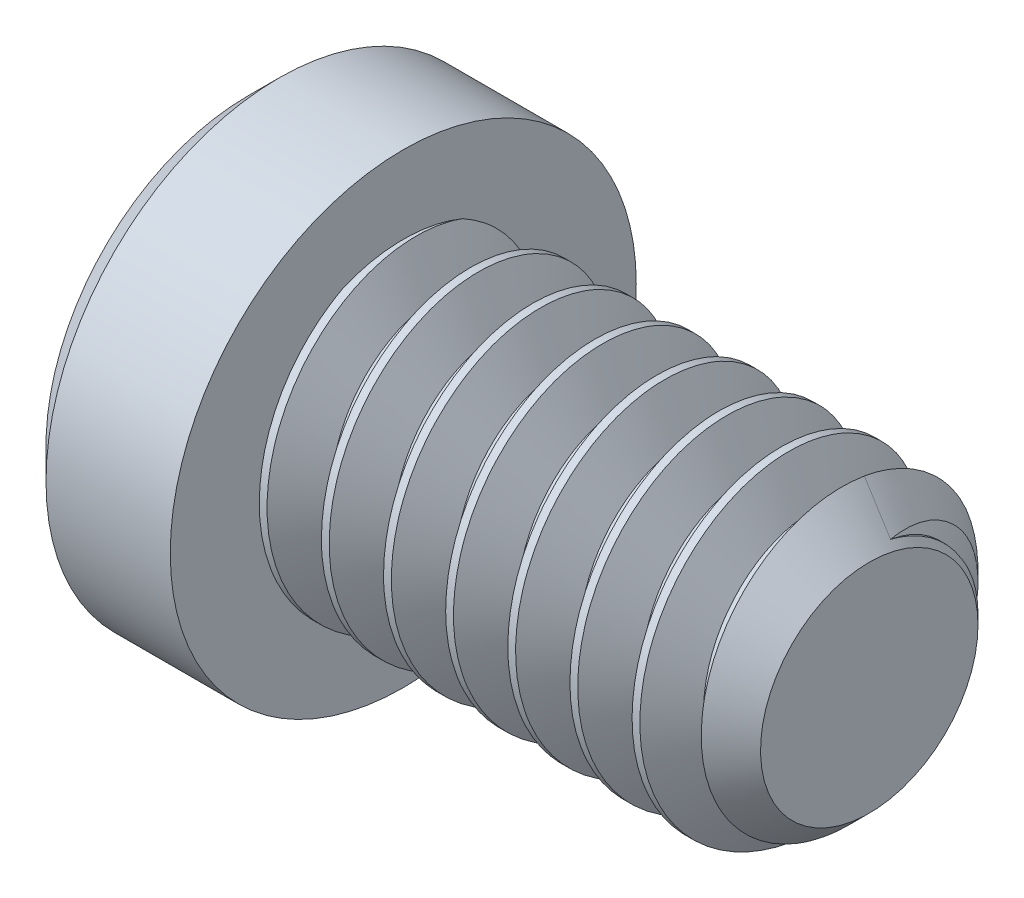
from build123d import *

# Parameters (mm, degrees)
SKETCH2_R           = 3.175
BOSS_EXTRUDE1_DEPTH = 9.525
CHAMFER1_SIZE       = 0.9525
CUT_SWEEP1_PITCH    = 1.27
CUT_EXTRUDE1_DEPTH  = 2.3876


with BuildPart() as part:
    # Sketch2 → Boss-Extrude1 (new body)
    with BuildSketch(Plane(origin=(4.7625, 0, 0), x_dir=(0, 0, -1), z_dir=(1, 0, 0))):
        Circle(SKETCH2_R)
    extrude(amount=-BOSS_EXTRUDE1_DEPTH)

    # Chamfer1
    chamfer1_edges = [part.edges().sort_by_distance(p)[0] for p in [
        (4.7625, 0, 3.175),
    ]]
    chamfer(chamfer1_edges, length=CHAMFER1_SIZE)

    # Cut-Sweep1: the profile of Sketch5 profile screwed along a right-hand helix of 8.5 turns, 8 arcs to a turn; built about Z, then put on its axis
    cut_sweep1_z = Axis((0, 0, 0), (0, 0, 1))
    cut_sweep1_corners = [(3.1753, 0, 0.555798205), (3.1753, 0, -0.555798205), (2.350110803, 0, -0.079375), (2.350110803, 0, 0.079375)]
    with BuildLine(mode=Mode.PRIVATE) as cut_sweep1_profile:
        Line(cut_sweep1_corners[0], cut_sweep1_corners[1])
        Line(cut_sweep1_corners[1], cut_sweep1_corners[2])
        Line(cut_sweep1_corners[2], cut_sweep1_corners[3])
        Line(cut_sweep1_corners[3], cut_sweep1_corners[0])
    cut_sweep1_cap = Face(cut_sweep1_profile.wire())
    cut_sweep1_turn_angles = [0, 22.5, 45, 67.5, 90, 112.5, 135, 157.5, 180, 202.5, 225, 247.5, 270, 292.5, 315, 337.5, 360]
    cut_sweep1_turn_weights = [1, 0.9238795325112867, 1, 0.9238795325112867, 1, 0.9238795325112867, 1, 0.9238795325112867, 1, 0.9238795325112867, 1, 0.9238795325112867, 1, 0.9238795325112867, 1, 0.9238795325112867, 1]
    cut_sweep1_turn_rails = [Edge.make_bspline([Vector(p[0], p[1], 0).rotate(cut_sweep1_z, cut_sweep1_turn_angles[k]) / cut_sweep1_turn_weights[k] + Vector(0, 0, p[2] + CUT_SWEEP1_PITCH * cut_sweep1_turn_angles[k] / 360) for k in range(17)], [0, 0, 0, 1, 1, 2, 2, 3, 3, 4, 4, 5, 5, 6, 6, 7, 7, 8, 8, 8], 2, cut_sweep1_turn_weights) for p in cut_sweep1_corners]
    cut_sweep1_turn_sides = [Face.make_surface_from_curves(cut_sweep1_turn_rails[p[0]], cut_sweep1_turn_rails[p[1]]) for p in [(0, 1), (1, 2), (2, 3), (3, 0)]]
    cut_sweep1_last_angles = [2880, 2902.5, 2925, 2947.5, 2970, 2992.5, 3015, 3037.5, 3060]
    cut_sweep1_last_weights = [1, 0.9238795325112867, 1, 0.9238795325112867, 1, 0.9238795325112867, 1, 0.9238795325112837, 1]
    cut_sweep1_last_rails = [Edge.make_bspline([Vector(p[0], p[1], 0).rotate(cut_sweep1_z, cut_sweep1_last_angles[k]) / cut_sweep1_last_weights[k] + Vector(0, 0, p[2] + CUT_SWEEP1_PITCH * cut_sweep1_last_angles[k] / 360) for k in range(9)], [0, 0, 0, 1, 1, 2, 2, 3, 3, 4, 4, 4], 2, cut_sweep1_last_weights) for p in cut_sweep1_corners]
    cut_sweep1_last_sides = [Face.make_surface_from_curves(cut_sweep1_last_rails[p[0]], cut_sweep1_last_rails[p[1]]) for p in [(0, 1), (1, 2), (2, 3), (3, 0)]]
    cut_sweep1 = Plane(origin=(4.7625, 0, 0), x_dir=(0, 1, 0), z_dir=(-1, 0, 0)) * Solid(Shell([*[p.moved(Location((0, 0, CUT_SWEEP1_PITCH * i))) for i in range(8) for p in cut_sweep1_turn_sides], *cut_sweep1_last_sides, cut_sweep1_cap, cut_sweep1_cap.rotate(cut_sweep1_z, 3060).moved(Location((0, 0, CUT_SWEEP1_PITCH * 3060 / 360)))]))
    add(cut_sweep1, mode=Mode.SUBTRACT)

    # Sketch6 → Revolve1 (revolve)
    with BuildSketch(Plane.XY, mode=Mode.PRIVATE) as revolve1_sk:
        Polygon((-7.3025, 4.7625), (-7.9375, 4.1275), (-7.9375, 0), (-4.7625, 0), (-4.7625, 4.7625), align=None)
    revolve(revolve1_sk.sketch.rotate(Axis((-4.7625, 0, 0), (-1, 0, 0)), 13.865622854), axis=Axis((-4.7625, 0, 0), (-1, 0, 0)))

    # Sketch4 → Cut-Extrude1 (cut)
    with BuildSketch(Plane(origin=(-7.9375, 0, 0), x_dir=(0, 0, -1), z_dir=(1, 0, 0))):
        Polygon((0, 1.833087105), (-1.5875, 0.916543552), (-1.5875, -0.916543552), (0, -1.833087105), (1.5875, -0.916543552), (1.5875, 0.916543552), align=None)
    extrude(amount=CUT_EXTRUDE1_DEPTH, mode=Mode.SUBTRACT)

    # Cut-Extrude2 cone 1 section (through the dimple's axis) → Cut-Extrude2 (revolve, cut)
    with BuildSketch(Plane(origin=(-7.9375, 0, 0), x_dir=(0, 0, 1), z_dir=(0, 1, 0))):
        Polygon((0, 0), (1.833087105, 0), (0, 1.833087105), align=None)
    revolve(axis=Axis((-7.9375, 0, 0), (1, 0, 0)), mode=Mode.SUBTRACT)


solid = part.part
